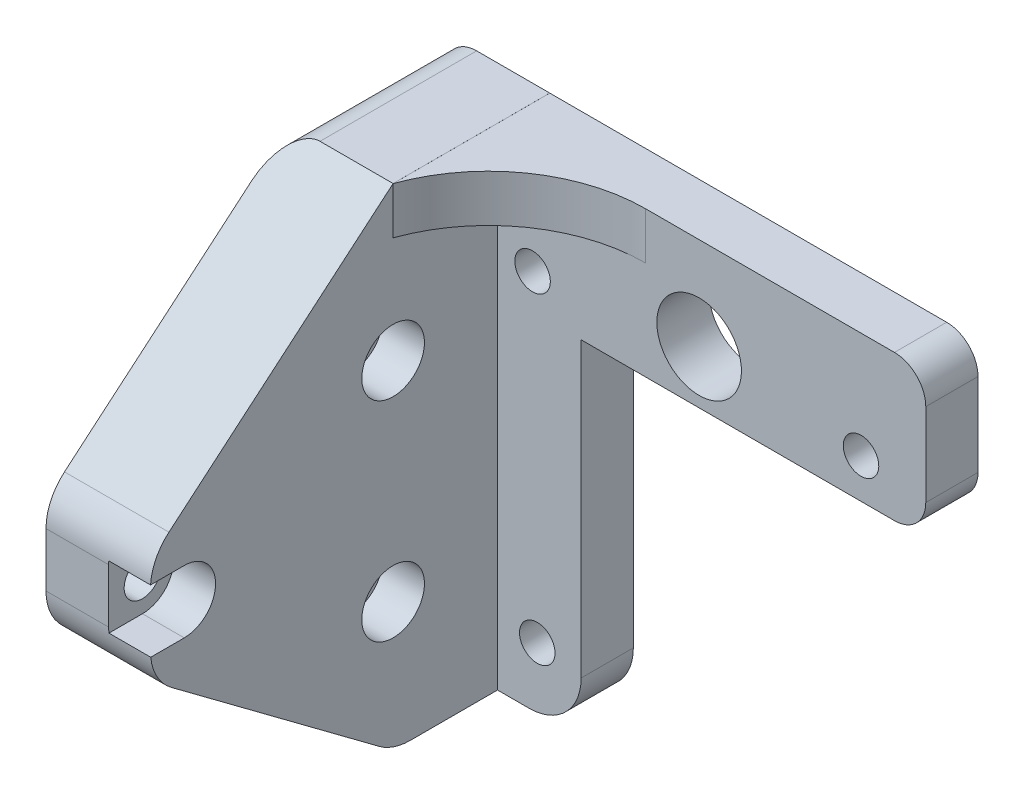
from build123d import *

# Parameters (mm, degrees)
SKETCH50_R         = 1.75
EXTRUDE1_DEPTH     = 10
SKETCH52_R         = 4.049984288
SKETCH52_R_2       = 1.7
EXTRUDE2_DEPTH     = 5
FILLET1_R          = 3
FILLET2_R          = 5
EXTRUDE3_DEPTH     = 4.5
FILLET4_R          = 5
FILLET5_R          = 3
SKETCH55_R         = 3
CUT_EXTRUDE3_DEPTH = 4


with BuildPart() as part:
    # Sketch50 → Extrude1 (new body)
    with BuildSketch(Plane(origin=(60, 0, 0), x_dir=(0, 0, -1), z_dir=(1, 0, 0))):
        Polygon((-38.234887292, -28), (-38.234887292, -38), (-15, -55.32486375), (0, -55.32486375), (0, -8.32486375), (-15, -8.32486375), align=None)
        with Locations((-35, -33)):
            Circle(SKETCH50_R, mode=Mode.SUBTRACT)
        with Locations((-15, -23)):
            Circle(SKETCH50_R, mode=Mode.SUBTRACT)
        with Locations((-15, -43)):
            Circle(SKETCH50_R, mode=Mode.SUBTRACT)
    extrude(amount=EXTRUDE1_DEPTH)

    # Sketch52 → Extrude2 (add)
    with BuildSketch(Plane(origin=(0, 0, 0), x_dir=(-1, 0, 0), z_dir=(0, 0, -1))):
        Polygon((-60.021067729, -55.328445544), (-60.021067729, -8.328445544), (-111, -8.328445544), (-111, -22.280627193), (-78, -22.280627193), (-78, -55.328445544), align=None)
        with Locations((-89.299980942, -17.200015896)):
            Circle(SKETCH52_R, mode=Mode.SUBTRACT)
        with Locations((-73.351535893, -18.931266408)):
            Circle(SKETCH52_R_2, mode=Mode.SUBTRACT)
        with Locations((-104.8, -18.5)):
            Circle(SKETCH52_R_2, mode=Mode.SUBTRACT)
        with Locations((-73.801481725, -49.508569042)):
            Circle(SKETCH52_R_2, mode=Mode.SUBTRACT)
    extrude(amount=-EXTRUDE2_DEPTH)

    # Fillet1
    fillet1_edges = [part.edges().sort_by_distance(p)[0] for p in [
        (111, -22.280627193, 2.5),
        (111, -8.328445544, 2.5),
    ]]
    fillet(fillet1_edges, radius=FILLET1_R)

    # Fillet2
    fillet2_edges = [part.edges().sort_by_distance(p)[0] for p in [
        (78, -55.328445544, 2.5),
    ]]
    fillet(fillet2_edges, radius=FILLET2_R)

    # Sketch54 → Extrude3 (add)
    with BuildSketch(Plane(origin=(0, -8.328445544, 0), x_dir=(1, 0, 0), z_dir=(0, 1, 0))):
        with BuildLine():
            Line((70, -15.001378441), (70, -5))
            Line((70, -5), (84.179453899, -5))
            ThreePointArc((84.179453899, -5), (75.50356081, -7.751902237), (70, -15.001378441))
        make_face()
    extrude(amount=-EXTRUDE3_DEPTH)

    # Fillet4
    fillet4_edges = [part.edges().sort_by_distance(p)[0] for p in [
        (65, -28, 38.234887292),
        (65, -38, 38.234887292),
        (65, -55.32486375, 15),
    ]]
    fillet(fillet4_edges, radius=FILLET4_R)

    # Fillet5
    fillet5_edges = [part.edges().sort_by_distance(p)[0] for p in [
        (60, -8.32486375, 7.5),
    ]]
    fillet(fillet5_edges, radius=FILLET5_R)

    # Sketch55 → Cut-Extrude3 (cut)
    with BuildSketch(Plane(origin=(70, 0, 0), x_dir=(0, 0, -1), z_dir=(1, 0, 0))):
        with Locations((-15, -23)):
            Circle(SKETCH55_R)
        with Locations((-15, -43)):
            Circle(SKETCH55_R)
        with BuildLine():
            Line((-35, -30), (-38.787900912, -30))
            Line((-38.787900912, -30), (-38.787900912, -36))
            Line((-38.787900912, -36), (-35, -36))
            ThreePointArc((-35, -36), (-32, -33), (-35, -30))
        make_face()
    extrude(amount=-CUT_EXTRUDE3_DEPTH, mode=Mode.SUBTRACT)


solid = part.part
